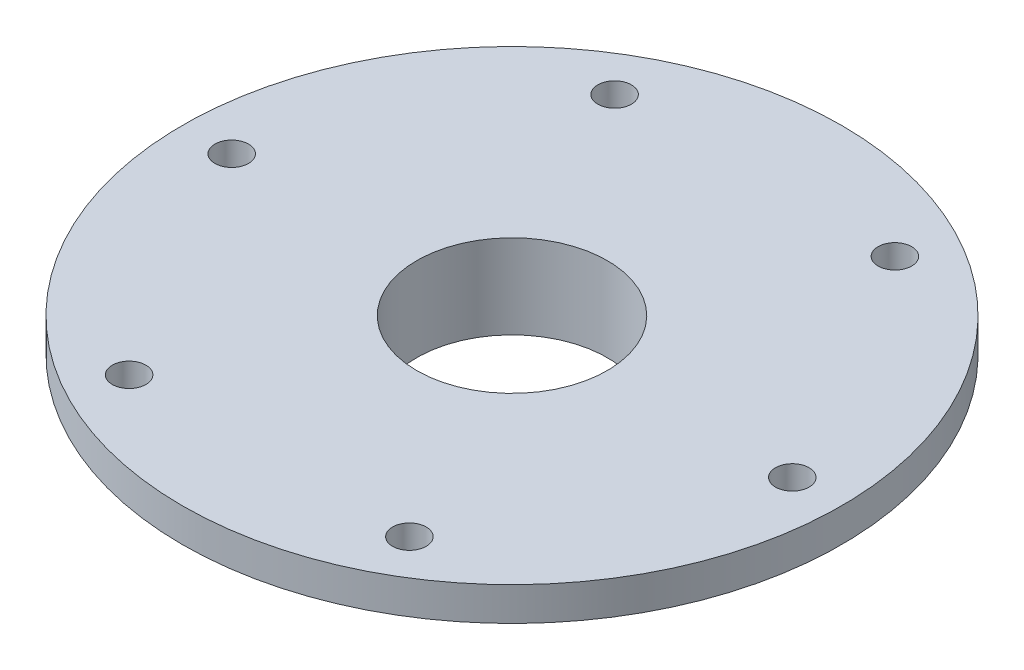
from build123d import *

# Parameters (mm, degrees)
SKETCH5_R          = 1.5
CUT_EXTRUDE1_DEPTH = 43.24020689


with BuildPart() as part:
    # Sketch4 → Revolve1 (revolve)
    with BuildSketch(Plane.XY):
        Polygon((-8.5, 0), (-29.39375, 0), (-29.39375, -3), (-11.75, -3), (-11.75, -7.5), (-8.5, -7.5), align=None)
    revolve(axis=Axis((0, 27.279243053, 0), (0, -1, 0)))

    # Sketch5 → Cut-Extrude1 (cut, through all)
    with BuildSketch(Plane(origin=(0, 0, 0), x_dir=(1, 0, 0), z_dir=(0, 1, 0))):
        with Locations((-25, 0)):
            Circle(SKETCH5_R)
        with Locations((-12.5, 21.650635095)):
            Circle(SKETCH5_R)
        with Locations((12.5, 21.650635095)):
            Circle(SKETCH5_R)
        with Locations((25, 0)):
            Circle(SKETCH5_R)
        with Locations((12.5, -21.650635095)):
            Circle(SKETCH5_R)
        with Locations((-12.5, -21.650635095)):
            Circle(SKETCH5_R)
    extrude(amount=-CUT_EXTRUDE1_DEPTH, mode=Mode.SUBTRACT)


solid = part.part
